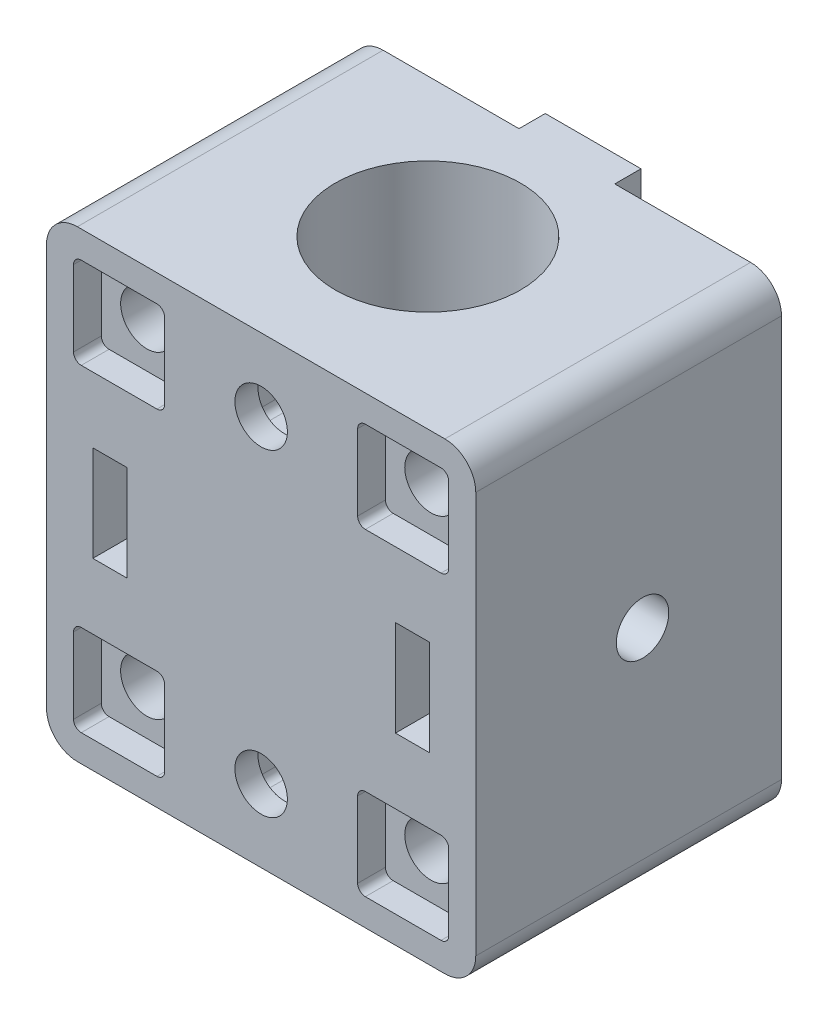
from build123d import *

# Parameters (mm, degrees)
SKETCH2_W               = 27.8
SKETCH2_H               = 18
SKETCH2_R               = 6
BOSS_EXTRUDE1_DEPTH     = 15
SKETCH7_W               = 13.9
SKETCH7_H               = 15
SKETCH7_W_2             = 5.9
SKETCH7_H_2             = 5.9
BOSS_EXTRUDE3_DEPTH     = 1.8
SKETCH8_R               = 1.7
CUT_EXTRUDE3_DEPTH      = 29.464890655
FILLET4_R               = 0.5
FILLET4_OF_MIRROR1_R    = 0.5
MIRROR2_START           = -9
MIRROR2_OUTLINE_R       = 1.7
MIRROR2_DEPTH           = 18
MIRROR2_START_2         = 9
MIRROR2_2_OUTLINE_W     = 13.9
MIRROR2_2_OUTLINE_H     = 30
MIRROR2_2_DEPTH         = 1.8
FILLET3_R               = 2
BOSS_EXTRUDE4_DEPTH     = 1.7
CUT_EXTRUDE4_REACH      = 33.173
CUT_EXTRUDE4_END_RADIUS = 6
CUT_EXTRUDE4_START      = -1.5
SKETCH10_W              = 5.9
SKETCH10_H              = 5.9
FILLET5_R               = 0.5
SKETCH11_R              = 1.7
CUT_EXTRUDE5_DEPTH      = 29.604370348
FILLET5_OF_MIRROR3_R    = 0.5
CUT_EXTRUDE6_START      = -10.8
SKETCH12_W              = 2.2
SKETCH12_H              = 6.2
CUT_EXTRUDE6_DEPTH      = 10.8
SKETCH13_W              = 2.2
SKETCH13_H              = 6.2
CUT_EXTRUDE7_DEPTH      = 2.95
CUT_EXTRUDE8_REACH      = 35.384
CUT_EXTRUDE8_END_RADIUS = 6
SKETCH14_R              = 1.7


# Read off the part's stored shape, not the designer's step: Mirror2
with BuildPart() as part:
    # Sketch2 → Boss-Extrude1 (new, symmetric)
    with BuildSketch(Plane(origin=(0, 0, 0), x_dir=(1, 0, 0), z_dir=(0, 1, 0))):
        Rectangle(SKETCH2_W, SKETCH2_H)
        with Locations(Location((0, 0, 0), (0, 0, 270))):
            Circle(SKETCH2_R, mode=Mode.SUBTRACT)
    extrude(amount=BOSS_EXTRUDE1_DEPTH, both=True)

    # Sketch7 → Boss-Extrude3 (add)
    with BuildSketch(Plane.XY.offset(9)):
        with Locations((-6.95, 7.5)):
            Rectangle(SKETCH7_W, SKETCH7_H)
        with Locations((-9.2, 10.3)):
            Rectangle(SKETCH7_W_2, SKETCH7_H_2, mode=Mode.SUBTRACT)
    boss_extrude3 = extrude(amount=BOSS_EXTRUDE3_DEPTH)

    # Sketch8 → Cut-Extrude3 (cut, through all)
    with BuildSketch(Plane.XY.offset(10.8)):
        with Locations((-9.2, 10.3)):
            Circle(SKETCH8_R)
    cut_extrude3 = extrude(amount=-CUT_EXTRUDE3_DEPTH, mode=Mode.SUBTRACT)

    # Fillet4
    fillet4_edges = [part.edges().sort_by_distance(p)[0] for p in [
        (-6.25, 13.25, 9.9),
        (-12.15, 13.25, 9.9),
        (-12.15, 7.35, 9.9),
        (-6.25, 7.35, 9.9),
    ]]
    fillet(fillet4_edges, radius=FILLET4_R)

    # Mirror1: Boss-Extrude3, Cut-Extrude3 across plane
    add(boss_extrude3.mirror(Plane.ZX))
    add(cut_extrude3.mirror(Plane.ZX), mode=Mode.SUBTRACT)

    # Fillet4 of Mirror1
    fillet4_of_mirror1_edges = [part.edges().sort_by_distance(p)[0] for p in [
        (-6.25, -13.25, 9.9),
        (-12.15, -13.25, 9.9),
        (-12.15, -7.35, 9.9),
        (-6.25, -7.35, 9.9),
    ]]
    fillet(fillet4_of_mirror1_edges, radius=FILLET4_OF_MIRROR1_R)

    # Mirror2 outline → Mirror2 (cut)
    with BuildSketch(Plane.XY.offset(MIRROR2_START)):
        with Locations((9.2, -10.3)):
            Circle(MIRROR2_OUTLINE_R)
        with Locations((9.2, 10.3)):
            Circle(MIRROR2_OUTLINE_R)
    extrude(amount=MIRROR2_DEPTH, mode=Mode.SUBTRACT)

    # Mirror2 2 outline → Mirror2 2 (add)
    with BuildSketch(Plane.XY.offset(MIRROR2_START_2)):
        with Locations((6.95, 0)):
            Rectangle(MIRROR2_2_OUTLINE_W, MIRROR2_2_OUTLINE_H)
        with BuildLine():
            ThreePointArc((6.25, -7.85), (6.396446609, -7.496446609), (6.75, -7.35))
            Line((6.75, -7.35), (11.65, -7.35))
            ThreePointArc((11.65, -7.35), (12.003553391, -7.496446609), (12.15, -7.85))
            Line((12.15, -7.85), (12.15, -12.75))
            ThreePointArc((12.15, -12.75), (12.003553391, -13.103553391), (11.65, -13.25))
            Line((11.65, -13.25), (6.75, -13.25))
            ThreePointArc((6.75, -13.25), (6.396446609, -13.103553391), (6.25, -12.75))
            Line((6.25, -12.75), (6.25, -7.85))
        make_face(mode=Mode.SUBTRACT)
        with BuildLine():
            Line((6.75, 13.25), (11.65, 13.25))
            ThreePointArc((11.65, 13.25), (12.003553391, 13.103553391), (12.15, 12.75))
            Line((12.15, 12.75), (12.15, 7.85))
            ThreePointArc((12.15, 7.85), (12.003553391, 7.496446609), (11.65, 7.35))
            Line((11.65, 7.35), (6.75, 7.35))
            ThreePointArc((6.75, 7.35), (6.396446609, 7.496446609), (6.25, 7.85))
            Line((6.25, 7.85), (6.25, 12.75))
            ThreePointArc((6.25, 12.75), (6.396446609, 13.103553391), (6.75, 13.25))
        make_face(mode=Mode.SUBTRACT)
    extrude(amount=MIRROR2_2_DEPTH)

    # Fillet3
    fillet3_edges = [part.edges().sort_by_distance(p)[0] for p in [
        (-13.9, 15, 0.9),
        (13.9, 15, 0.9),
        (-13.9, -15, 0.9),
        (13.9, -15, 0.9),
    ]]
    fillet(fillet3_edges, radius=FILLET3_R)

    # Sketch9 → Boss-Extrude4 (add)
    with BuildSketch(Plane(origin=(0, 0, -9), x_dir=(-1, 0, 0), z_dir=(0, 0, -1))):
        Polygon((-3.1, 15), (3.1, 15), (3.1, 6), (4.1, 6), (4.1, -15), (-4.1, -15), (-4.1, 6), (-3.1, 6), align=None)
    extrude(amount=BOSS_EXTRUDE4_DEPTH)

    # Cut-Extrude4: up to this cylinder (the profile starts outside it)
    cut_extrude4_end = Plane(origin=(0, 10.3, 0), z_dir=(0, -1, 0)) * Cylinder(CUT_EXTRUDE4_END_RADIUS, 79.346, mode=Mode.PRIVATE)
    # Sketch10 → Cut-Extrude4 (cut, up to the surface)
    with BuildSketch(Plane.XY.offset(10.8).offset(CUT_EXTRUDE4_START), mode=Mode.PRIVATE) as cut_extrude4_sk1:
        with Locations((0, 10.3)):
            Rectangle(SKETCH10_W, SKETCH10_H)
    cut_extrude4_tool1 = extrude(cut_extrude4_sk1.sketch, amount=-CUT_EXTRUDE4_REACH, mode=Mode.PRIVATE) - cut_extrude4_end
    cut_extrude4 = cut_extrude4_tool1.solids().sort_by_distance((0, 10.3, 9.3))[0]
    add(cut_extrude4, mode=Mode.SUBTRACT)

    # Fillet5
    fillet5_edges = [part.edges().sort_by_distance(p)[0] for p in [
        (2.95, 13.25, 7.262350474),
        (2.95, 7.35, 7.262350474),
        (-2.95, 7.35, 7.262350474),
        (-2.95, 13.25, 7.262350474),
    ]]
    fillet(fillet5_edges, radius=FILLET5_R)

    # Sketch11 → Cut-Extrude5 (cut, through all)
    with BuildSketch(Plane(origin=(0, 0, 9.3), x_dir=(-1, 0, 0), z_dir=(0, 0, -1))):
        with Locations((0, 10.3)):
            Circle(SKETCH11_R)
    cut_extrude5 = extrude(amount=-CUT_EXTRUDE5_DEPTH, mode=Mode.SUBTRACT)

    # Mirror3: Cut-Extrude4, Cut-Extrude5 across plane
    add(cut_extrude4.mirror(Plane.ZX), mode=Mode.SUBTRACT)
    add(cut_extrude5.mirror(Plane.ZX), mode=Mode.SUBTRACT)

    # Fillet5 of Mirror3
    fillet5_of_mirror3_edges = [part.edges().sort_by_distance(p)[0] for p in [
        (2.95, -13.25, 7.262350474),
        (2.95, -7.35, 7.262350474),
        (-2.95, -7.35, 7.262350474),
        (-2.95, -13.25, 7.262350474),
    ]]
    fillet(fillet5_of_mirror3_edges, radius=FILLET5_OF_MIRROR3_R)

    # Sketch12 → Cut-Extrude6 (cut)
    with BuildSketch(Plane.XY.offset(10.8).offset(CUT_EXTRUDE6_START)):
        with Locations((-9.8, 0)):
            Rectangle(SKETCH12_W, SKETCH12_H)
    cut_extrude6 = extrude(amount=CUT_EXTRUDE6_DEPTH, mode=Mode.SUBTRACT)

    # Sketch13 → Cut-Extrude7 (cut)
    with BuildSketch(Plane.XY):
        with Locations((-9.8, 0)):
            Rectangle(SKETCH13_W, SKETCH13_H)
    cut_extrude7 = extrude(amount=-CUT_EXTRUDE7_DEPTH, mode=Mode.SUBTRACT)

    # Cut-Extrude8: up to this cylinder (the profile starts outside it)
    cut_extrude8_end = Plane(origin=(0, 0, 0), z_dir=(0, -1, 0)) * Cylinder(CUT_EXTRUDE8_END_RADIUS, 83.768, mode=Mode.PRIVATE)
    # Sketch14 → Cut-Extrude8 (cut, up to the surface)
    with BuildSketch(Plane.ZY.offset(13.9), mode=Mode.PRIVATE) as cut_extrude8_sk1:
        Circle(SKETCH14_R)
    cut_extrude8_tool1 = extrude(cut_extrude8_sk1.sketch, amount=-CUT_EXTRUDE8_REACH, mode=Mode.PRIVATE) - cut_extrude8_end
    cut_extrude8 = cut_extrude8_tool1.solids().sort_by_distance((-13.9, 0, 0))[0]
    add(cut_extrude8, mode=Mode.SUBTRACT)

    # Mirror4: Cut-Extrude6, Cut-Extrude7, Cut-Extrude8 across plane
    add(cut_extrude6.mirror(Plane(origin=(0, 0, 0), x_dir=(0, 0, 1), z_dir=(1, 0, 0))), mode=Mode.SUBTRACT)
    add(cut_extrude7.mirror(Plane(origin=(0, 0, 0), x_dir=(0, 0, 1), z_dir=(1, 0, 0))), mode=Mode.SUBTRACT)
    add(cut_extrude8.mirror(Plane(origin=(0, 0, 0), x_dir=(0, 0, 1), z_dir=(1, 0, 0))), mode=Mode.SUBTRACT)


solid = part.part
